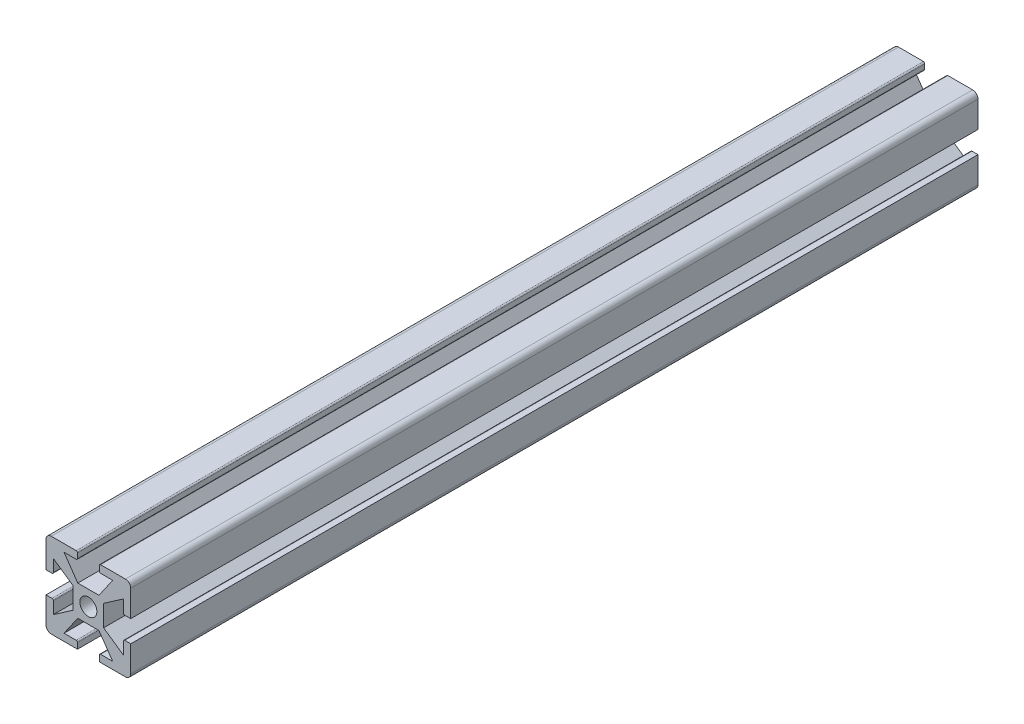
from build123d import *

# Parameters (mm, degrees)
SKETCH1_W           = 25.4
SKETCH1_H           = 25.4
BOSS_EXTRUDE1_DEPTH = 254
FILLET1_R           = 1.5875
HOLE1_OUTLINE_R     = 2.5527
HOLE1_DEPTH         = 254
SKETCH7_W           = 6.5278
SKETCH7_H           = 2.2352
CUT_EXTRUDE2_DEPTH  = 254
FILLET4_R           = 0.396875
CIRPATTERN2_DEPTH   = 254


# Read off the part's stored shape, not the designer's step: Hole1, CirPattern2
with BuildPart() as part:
    # Sketch1 → Boss-Extrude1 (new body)
    with BuildSketch(Plane.XY):
        Rectangle(SKETCH1_W, SKETCH1_H)
    extrude(amount=BOSS_EXTRUDE1_DEPTH)

    # Fillet1
    fillet1_edges = [part.edges().sort_by_distance(p)[0] for p in [
        (12.7, -12.7, 127),
        (-12.7, -12.7, 127),
        (-12.7, 12.7, 127),
        (12.7, 12.7, 127),
    ]]
    fillet(fillet1_edges, radius=FILLET1_R)

    # Hole1 outline → Hole1 (cut)
    with BuildSketch(Plane.XY):
        with Locations((0, -0.048792482)):
            Circle(HOLE1_OUTLINE_R)
    extrude(amount=HOLE1_DEPTH, mode=Mode.SUBTRACT)

    # Sketch7 → Cut-Extrude2 (cut)
    with BuildSketch(Plane.XY.offset(254)):
        with Locations((0, 11.5824)):
            Rectangle(SKETCH7_W, SKETCH7_H)
        Polygon((-3.175, 4.5212), (-7.3025, 10.4648), (7.3025, 10.4648), (3.175, 4.5212), align=None)
    extrude(amount=-CUT_EXTRUDE2_DEPTH, mode=Mode.SUBTRACT)

    # Fillet4
    fillet4_edges = [part.edges().sort_by_distance(p)[0] for p in [
        (-3.2639, 10.4648, 127),
        (-3.2639, 12.7, 127),
        (3.2639, 12.7, 127),
        (3.2639, 10.4648, 127),
    ]]
    fillet(fillet4_edges, radius=FILLET4_R)

    # CirPattern2 outline → CirPattern2 (cut)
    with BuildSketch(Plane.XY):
        with BuildLine():
            ThreePointArc((-3.660775, -10.562384964), (-3.380141996, -10.67862696), (-3.2639, -10.959259964))
            Line((-3.2639, -10.959259964), (-3.2639, -12.7))
            Line((-3.2639, -12.7), (3.2639, -12.7))
            Line((3.2639, -12.7), (3.2639, -10.959259964))
            ThreePointArc((3.2639, -10.959259964), (3.380141996, -10.67862696), (3.660775, -10.562384964))
            Line((3.660775, -10.562384964), (7.3025, -10.562384964))
            Line((7.3025, -10.562384964), (3.175, -4.618784964))
            Line((3.175, -4.618784964), (-3.175, -4.618784964))
            Line((-3.175, -4.618784964), (-7.3025, -10.562384964))
            Line((-7.3025, -10.562384964), (-3.660775, -10.562384964))
        make_face()
        with BuildLine():
            Line((-12.7, -3.312692482), (-10.910467482, -3.312692482))
            ThreePointArc((-10.910467482, -3.312692482), (-10.629834478, -3.428934478), (-10.513592482, -3.709567482))
            Line((-10.513592482, -3.709567482), (-10.513592482, -7.351292482))
            Line((-10.513592482, -7.351292482), (-4.569992482, -3.223792482))
            Line((-4.569992482, -3.223792482), (-4.569992482, 3.126207518))
            Line((-4.569992482, 3.126207518), (-10.513592482, 7.253707518))
            Line((-10.513592482, 7.253707518), (-10.513592482, 3.611982518))
            ThreePointArc((-10.513592482, 3.611982518), (-10.629834478, 3.331349514), (-10.910467482, 3.215107518))
            Line((-10.910467482, 3.215107518), (-12.7, 3.215107518))
            Line((-12.7, 3.215107518), (-12.7, -3.312692482))
        make_face()
        with BuildLine():
            ThreePointArc((10.513592482, -3.709567482), (10.629834478, -3.428934478), (10.910467482, -3.312692482))
            Line((10.910467482, -3.312692482), (12.7, -3.312692482))
            Line((12.7, -3.312692482), (12.7, 3.215107518))
            Line((12.7, 3.215107518), (10.910467482, 3.215107518))
            ThreePointArc((10.910467482, 3.215107518), (10.629834478, 3.331349514), (10.513592482, 3.611982518))
            Line((10.513592482, 3.611982518), (10.513592482, 7.253707518))
            Line((10.513592482, 7.253707518), (4.569992482, 3.126207518))
            Line((4.569992482, 3.126207518), (4.569992482, -3.223792482))
            Line((4.569992482, -3.223792482), (10.513592482, -7.351292482))
            Line((10.513592482, -7.351292482), (10.513592482, -3.709567482))
        make_face()
    extrude(amount=CIRPATTERN2_DEPTH, mode=Mode.SUBTRACT)


solid = part.part
